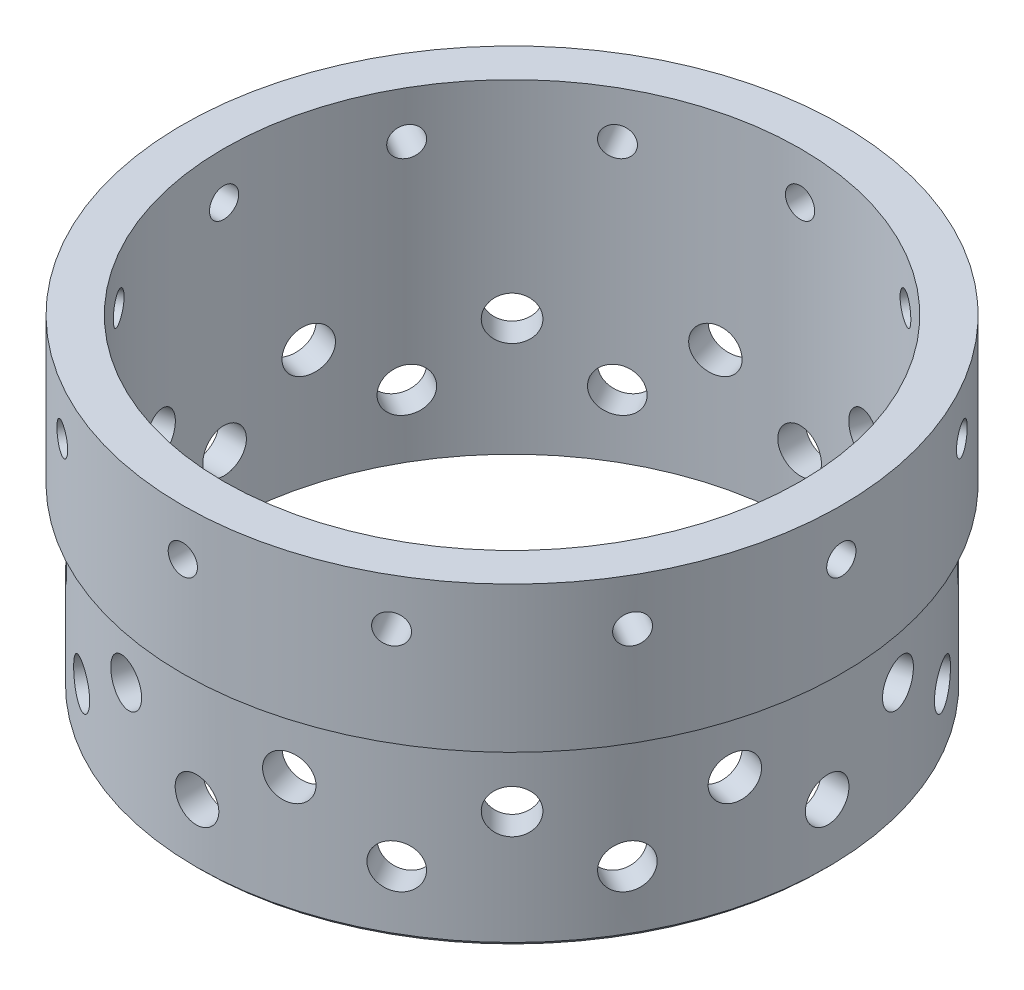
from build123d import *

# Parameters (mm, degrees)
SKETCH1_R           = 76.1238
SKETCH1_R_2         = 66.5988
BOSS_EXTRUDE1_DEPTH = 12.7
BOSS_EXTRUDE2_START = -41.275
SKETCH1_3_R         = 72.9488
SKETCH1_3_R_2       = 66.5988
BOSS_EXTRUDE2_DEPTH = 41.275
SKETCH1_4_R         = 76.1238
SKETCH1_4_R_2       = 66.5988
BOSS_EXTRUDE3_DEPTH = 33.655
CHAMFER1_SIZE       = 1
SKETCH2_R           = 5.0419
CUT_EXTRUDE1_DEPTH  = 116.296537146
SKETCH3_R           = 5.0419
CUT_EXTRUDE2_DEPTH  = 38.1
CIRPATTERN2_COUNT   = 12
SKETCH2_3_R         = 3.3782
CUT_EXTRUDE3_DEPTH  = 116.296537182
CIRPATTERN3_COUNT   = 12
FILLET1_R           = 0.4064


with BuildPart() as part:
    # Sketch1 → Boss-Extrude1 (new body)
    with BuildSketch(Plane(origin=(0, 0, 0), x_dir=(1, 0, 0), z_dir=(0, 1, 0))):
        Circle(SKETCH1_R)
        Circle(SKETCH1_R_2, mode=Mode.SUBTRACT)
    extrude(amount=BOSS_EXTRUDE1_DEPTH)

    # Sketch1<3> → Boss-Extrude2 (add)
    with BuildSketch(Plane(origin=(0, 0, 0), x_dir=(1, 0, 0), z_dir=(0, 1, 0)).offset(BOSS_EXTRUDE2_START)):
        Circle(SKETCH1_3_R)
        Circle(SKETCH1_3_R_2, mode=Mode.SUBTRACT)
    extrude(amount=BOSS_EXTRUDE2_DEPTH)

    # Sketch1<4> → Boss-Extrude3 (add)
    with BuildSketch(Plane(origin=(0, 0, 0), x_dir=(1, 0, 0), z_dir=(0, 1, 0))):
        Circle(SKETCH1_4_R)
        Circle(SKETCH1_4_R_2, mode=Mode.SUBTRACT)
    extrude(amount=BOSS_EXTRUDE3_DEPTH)

    # Chamfer1
    chamfer1_edges = [part.edges().sort_by_distance(p)[0] for p in [
        (-72.9488, -41.275, 0),
    ]]
    chamfer(chamfer1_edges, length=CHAMFER1_SIZE)

    # Sketch2 → Cut-Extrude1 (cut, through all)
    with BuildSketch(Plane.XY):
        with Locations((0, -26.797)):
            Circle(SKETCH2_R)
    cut_extrude1 = extrude(amount=-CUT_EXTRUDE1_DEPTH, mode=Mode.SUBTRACT)

    # Sketch3 → Cut-Extrude2 (cut)
    with BuildSketch(Plane(origin=(-19.702289226, 0, 73.529944415), x_dir=(0, -1, 0), z_dir=(-0.25881904510252135, 0, 0.9659258262890681))):
        with Locations((14.097, 0)):
            Circle(SKETCH3_R)
    cut_extrude2 = extrude(amount=-CUT_EXTRUDE2_DEPTH, mode=Mode.SUBTRACT)

    # CirPattern2: Cut-Extrude1, Cut-Extrude2 ×12 about axis
    cirpattern2_axis = Axis((0, 12.7, 0), (0, -1, 0))
    add([cut_extrude1.rotate(cirpattern2_axis, i * 360 / CIRPATTERN2_COUNT) for i in range(1, CIRPATTERN2_COUNT)], mode=Mode.SUBTRACT)
    add([cut_extrude2.rotate(cirpattern2_axis, i * 360 / CIRPATTERN2_COUNT) for i in range(1, CIRPATTERN2_COUNT)], mode=Mode.SUBTRACT)

    # Sketch2<3> → Cut-Extrude3 (cut, through all)
    with BuildSketch(Plane.XY):
        with Locations((0, 22.86)):
            Circle(SKETCH2_3_R)
    cut_extrude3 = extrude(amount=-CUT_EXTRUDE3_DEPTH, mode=Mode.SUBTRACT)

    # CirPattern3: Cut-Extrude3 ×12 about axis
    cirpattern3_axis = Axis((0, 12.7, 0), (0, -1, 0))
    for i in range(1, CIRPATTERN3_COUNT):
        add(cut_extrude3.rotate(cirpattern3_axis, i * 360 / CIRPATTERN3_COUNT), mode=Mode.SUBTRACT)

    # Fillet1
    fillet1_edges = [part.edges().sort_by_distance(p)[0] for p in [
        (-72.9488, 0, 0),
    ]]
    fillet(fillet1_edges, radius=FILLET1_R)


solid = part.part
